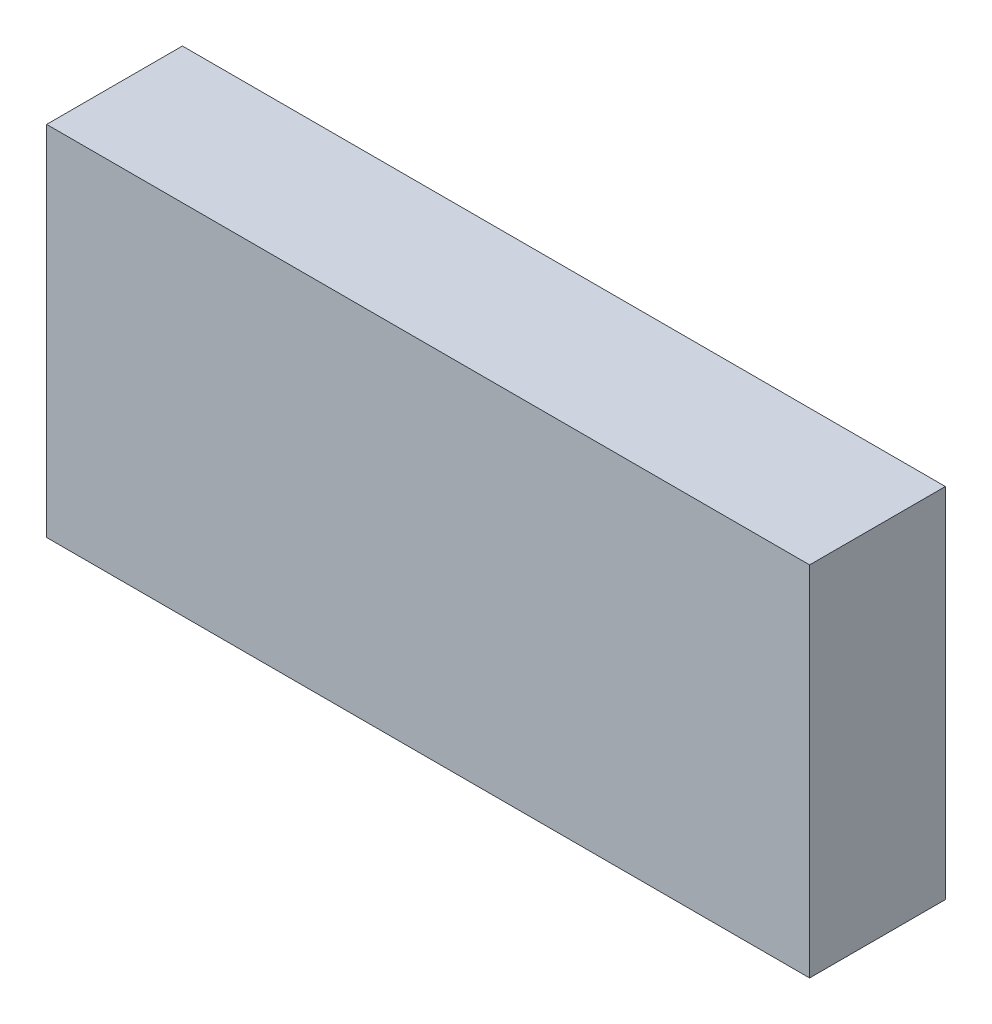
from build123d import *

# Parameters (mm, degrees)
SKETCH1_W           = 44.958
SKETCH1_H           = 21.082
BOSS_EXTRUDE1_DEPTH = 8.000001602


with BuildPart() as part:
    # Sketch1 → Boss-Extrude1 (new body)
    with BuildSketch(Plane.XY):
        Rectangle(SKETCH1_W, SKETCH1_H)
    extrude(amount=BOSS_EXTRUDE1_DEPTH)


solid = part.part
